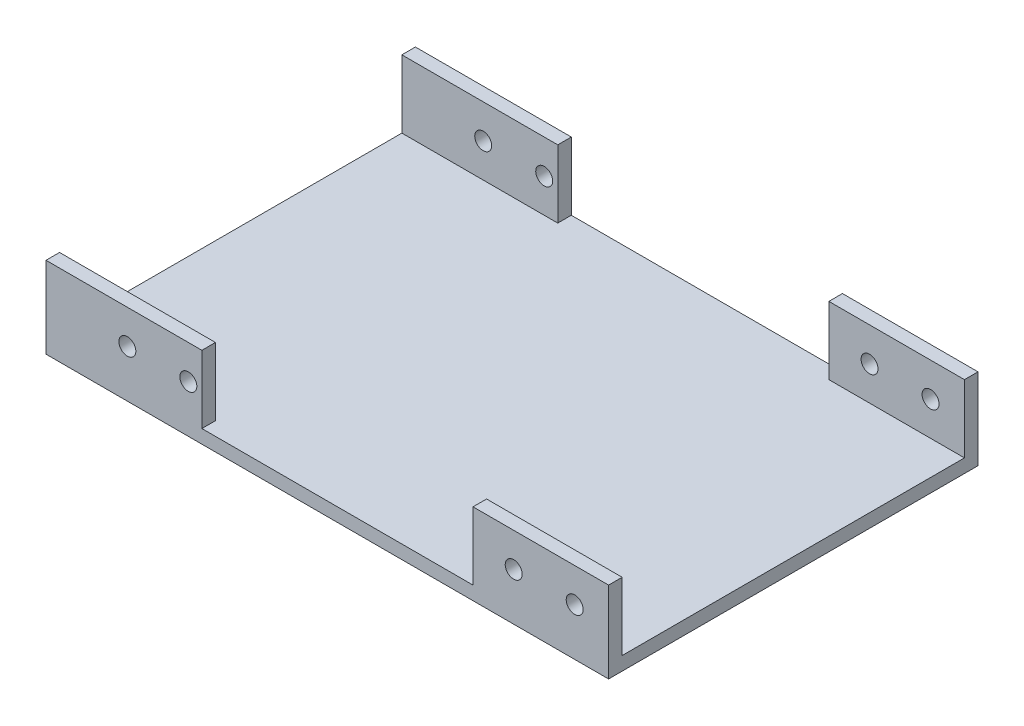
from build123d import *

# Parameters (mm, degrees)
SKETCH1_W           = 83
SKETCH1_H           = 54.5
BOSS_EXTRUDE1_DEPTH = 2
SKETCH2_W           = 20
SKETCH2_H           = 2
SKETCH2_W_2         = 23
BOSS_EXTRUDE2_DEPTH = 10
SKETCH3_R           = 1.25
CUT_EXTRUDE1_DEPTH  = 84.415047374


with BuildPart() as part:
    # Sketch1 → Boss-Extrude1 (new body)
    with BuildSketch(Plane(origin=(0, 0, 0), x_dir=(1, 0, 0), z_dir=(0, 1, 0))):
        with Locations((-20.498549405, 1.944031796)):
            Rectangle(SKETCH1_W, SKETCH1_H)
    extrude(amount=BOSS_EXTRUDE1_DEPTH)

    # Sketch2 → Boss-Extrude2 (add)
    with BuildSketch(Plane(origin=(0, 2, 0), x_dir=(1, 0, 0), z_dir=(0, 1, 0))):
        with Locations((11.001450595, 28.194031796)):
            Rectangle(SKETCH2_W, SKETCH2_H)
        with Locations((11.001450595, -24.305968204)):
            Rectangle(SKETCH2_W, SKETCH2_H)
        with Locations((-50.498549405, 28.194031796)):
            Rectangle(SKETCH2_W_2, SKETCH2_H)
        with Locations((-50.498549405, -24.305968204)):
            Rectangle(SKETCH2_W_2, SKETCH2_H)
    extrude(amount=BOSS_EXTRUDE2_DEPTH)

    # Sketch3 → Cut-Extrude1 (cut, through all)
    with BuildSketch(Plane.XY.offset(25.305968204)):
        with Locations((16.001450595, 7)):
            Circle(SKETCH3_R)
        with Locations((7.001450595, 7)):
            Circle(SKETCH3_R)
        with Locations((-40.998549405, 7)):
            Circle(SKETCH3_R)
        with Locations((-49.998549405, 7)):
            Circle(SKETCH3_R)
    extrude(amount=-CUT_EXTRUDE1_DEPTH, mode=Mode.SUBTRACT)


solid = part.part
